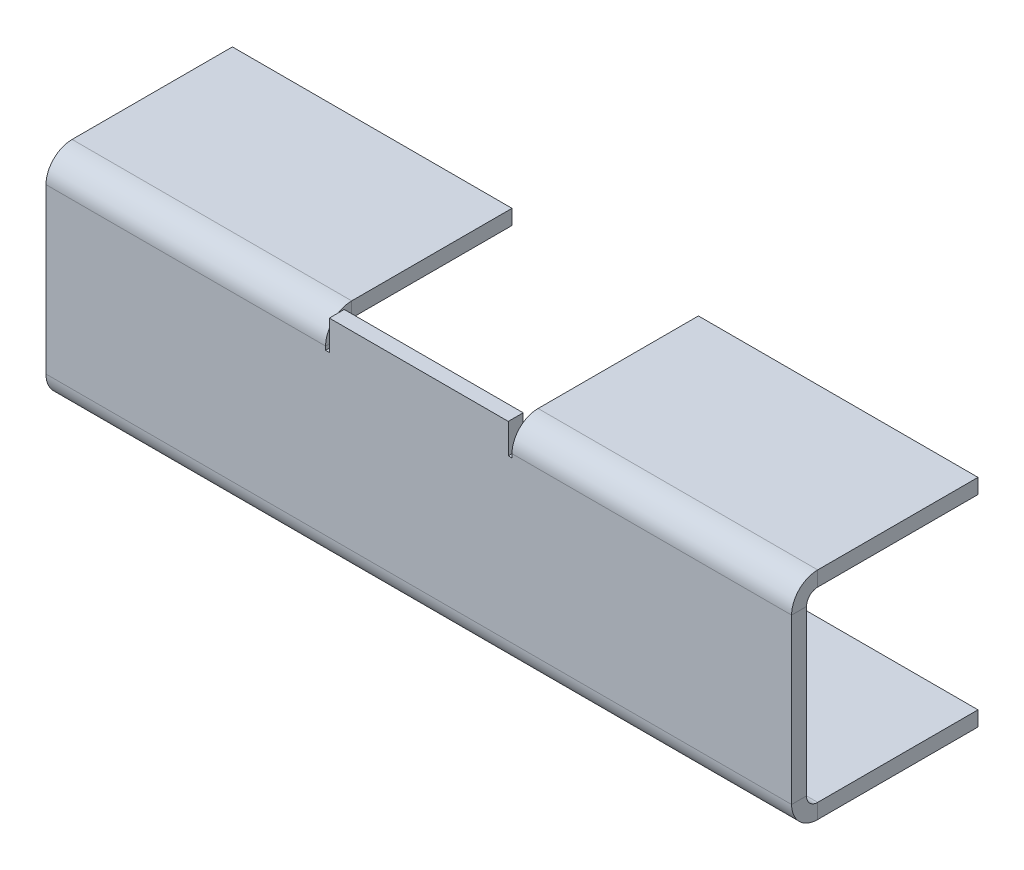
from build123d import *

# Parameters (mm, degrees)
SKETCH_1_W                         = 100
SKETCH_1_H                         = 25
SM_BASE_FLANGE_1_DEPTH             = 2
SM_EDGE_FLANGE_1_STRIP_W           = 11
SM_EDGE_FLANGE_1_STRIP_H           = 2
SM_EDGE_FLANGE_1_STRIP_CUT_DEPTH   = 100
SM_EDGE_FLANGE_1_STRIP_2_W         = 11
SM_EDGE_FLANGE_1_STRIP_2_H         = 2
SM_EDGE_FLANGE_1_STRIP_CUT_2_DEPTH = 100
SM_EDGE_FLANGE_1_DEPTH             = 100
SM_EDGE_FLANGE_1_BEND_DEPTH        = 100
SKETCH_12_W                        = 25
SKETCH_12_H                        = 25
CUT_EXTRUDE_1_DEPTH                = 4
SKETCH_24_W                        = 24
SKETCH_24_H                        = 4
EXTRUDE_1_DEPTH                    = 2


# Sheet-metal steps are written as plain solids
with BuildPart() as part:
    # Sketch 1 → Базовая кромка1 (new body)
    with BuildSketch(Plane.XY):
        Rectangle(SKETCH_1_W, SKETCH_1_H)
    extrude(amount=-SM_BASE_FLANGE_1_DEPTH)

    # Ребро-кромка1 strip (across the edge) → Ребро-кромка1 strip cut (cut)
    with BuildSketch(Plane(origin=(-50, 12.5, -2), x_dir=(0, -1, 0), z_dir=(1, 0, 0))):
        with Locations((-4, -1)):
            Rectangle(SM_EDGE_FLANGE_1_STRIP_W, SM_EDGE_FLANGE_1_STRIP_H)
    extrude(amount=SM_EDGE_FLANGE_1_STRIP_CUT_DEPTH, mode=Mode.SUBTRACT)

    # Ребро-кромка1 strip 2 (across the edge) → Ребро-кромка1 strip cut 2 (cut)
    with BuildSketch(Plane(origin=(50, -12.5, -2), x_dir=(0, 1, 0), z_dir=(-1, 0, 0))):
        with Locations((-4, -1)):
            Rectangle(SM_EDGE_FLANGE_1_STRIP_2_W, SM_EDGE_FLANGE_1_STRIP_2_H)
    extrude(amount=SM_EDGE_FLANGE_1_STRIP_CUT_2_DEPTH, mode=Mode.SUBTRACT)

    # Ребро-кромка1 section (across the edge) → Ребро-кромка1 (add)
    with BuildSketch(Plane(origin=(-50, 12.5, -2), x_dir=(0, -1, 0), z_dir=(1, 0, 0))):
        with BuildLine():
            Line((-2, 1.5), (-2, 23))
            Line((-2, 23), (0, 23))
            Line((0, 23), (0, 1.5))
            ThreePointArc((0, 1.5), (0.439339828, 0.439339828), (1.5, 0))
            Line((1.5, 0), (1.5, -2))
            ThreePointArc((1.5, -2), (-0.974873734, -0.974873734), (-2, 1.5))
        make_face()
    extrude(amount=SM_EDGE_FLANGE_1_DEPTH)

    # Ребро-кромка1 section 2 (across the edge) → Ребро-кромка1 bend (add)
    with BuildSketch(Plane(origin=(50, -12.5, -2), x_dir=(0, 1, 0), z_dir=(-1, 0, 0))):
        with BuildLine():
            Line((-2, 1.5), (-2, 23))
            Line((-2, 23), (0, 23))
            Line((0, 23), (0, 1.5))
            ThreePointArc((0, 1.5), (0.439339828, 0.439339828), (1.5, 0))
            Line((1.5, 0), (1.5, -2))
            ThreePointArc((1.5, -2), (-0.974873734, -0.974873734), (-2, 1.5))
        make_face()
    extrude(amount=SM_EDGE_FLANGE_1_BEND_DEPTH)

    # Эскиз12 → Вырез-Вытянуть1 (cut)
    with BuildSketch(Plane(origin=(0, 14.5, 0), x_dir=(1, 0, 0), z_dir=(0, 1, 0))):
        with Locations((0, 12.5)):
            Rectangle(SKETCH_12_W, SKETCH_12_H)
    extrude(amount=-CUT_EXTRUDE_1_DEPTH, mode=Mode.SUBTRACT)

    # Эскиз24 → Бобышка-Вытянуть1 (add)
    with BuildSketch(Plane.XY):
        with Locations((0, 12.5)):
            Rectangle(SKETCH_24_W, SKETCH_24_H)
    extrude(amount=-EXTRUDE_1_DEPTH)


solid = part.part
